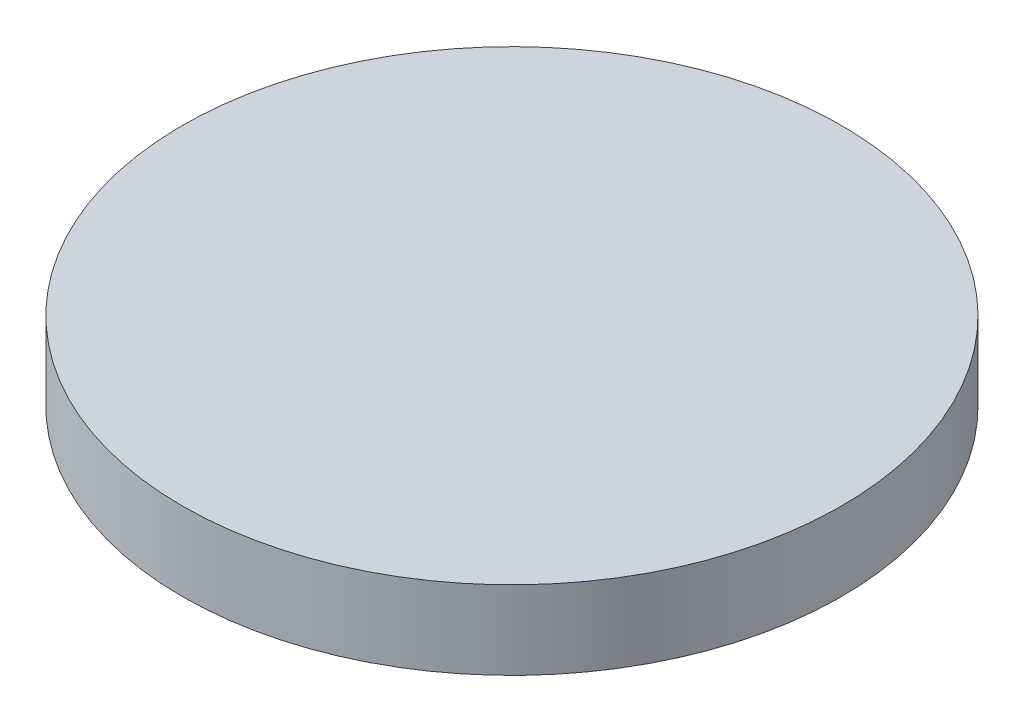
from build123d import *

# Parameters (mm, degrees)
SKETCH1_R               = 21
BOSS_EXTRUDE1_DEPTH     = 5
SKETCH2_R               = 4.863
BOSS_EXTRUDE2_DEPTH     = 7
SWEEP1_PITCH            = 1.75
SWEEP1_HEIGHT           = 7
SWEEP1_RADIUS           = 6
SWEEP1_START_ANGLE      = 90
CUT_EXTRUDE1_DEPTH      = 33.325986765
CUT_EXTRUDE1_DEPTH_BACK = 33.325986765


with BuildPart() as part:
    # Sketch1 → Boss-Extrude1 (new body)
    with BuildSketch(Plane(origin=(0, 0, 0), x_dir=(1, 0, 0), z_dir=(0, 1, 0))):
        Circle(SKETCH1_R)
    extrude(amount=-BOSS_EXTRUDE1_DEPTH)

    # Sketch2 → Boss-Extrude2 (add)
    with BuildSketch(Plane.XZ.offset(5)):
        Circle(SKETCH2_R)
    extrude(amount=BOSS_EXTRUDE2_DEPTH)

    # Sweep1: sweep along a helix
    with BuildLine() as sweep1_path:
        add(Helix(SWEEP1_PITCH, SWEEP1_HEIGHT, SWEEP1_RADIUS, center=(0, -12, 0), direction=(0, 1, 0), lefthand=True, mode=Mode.PRIVATE).rotate(Axis((0, -12, 0), (0, 1, 0)), SWEEP1_START_ANGLE))
    # Sketch11 → Sweep1 (sweep)
    with BuildSketch(Plane.XY):
        Polygon((4.826232454, -5), (4.826232454, -5.765947256), (5.963232454, -5.1095), (5.963232454, -4.8905), (4.826232454, -4.234052744), align=None)
    sweep(path=sweep1_path.line, is_frenet=True)

    # Sketch12 → Cut-Extrude1 (cut, two sides: drawn at the far end of the back side and taken through both)
    with BuildSketch(Plane.XY.offset(-CUT_EXTRUDE1_DEPTH_BACK)):
        Polygon((0, -12), (5.963232454, -12), (5.963232454, -12.765947256), (0, -12.765947256), (-4.863, -12.765947256), (-4.863, -12), align=None)
    extrude(amount=CUT_EXTRUDE1_DEPTH + CUT_EXTRUDE1_DEPTH_BACK, mode=Mode.SUBTRACT)


solid = part.part
